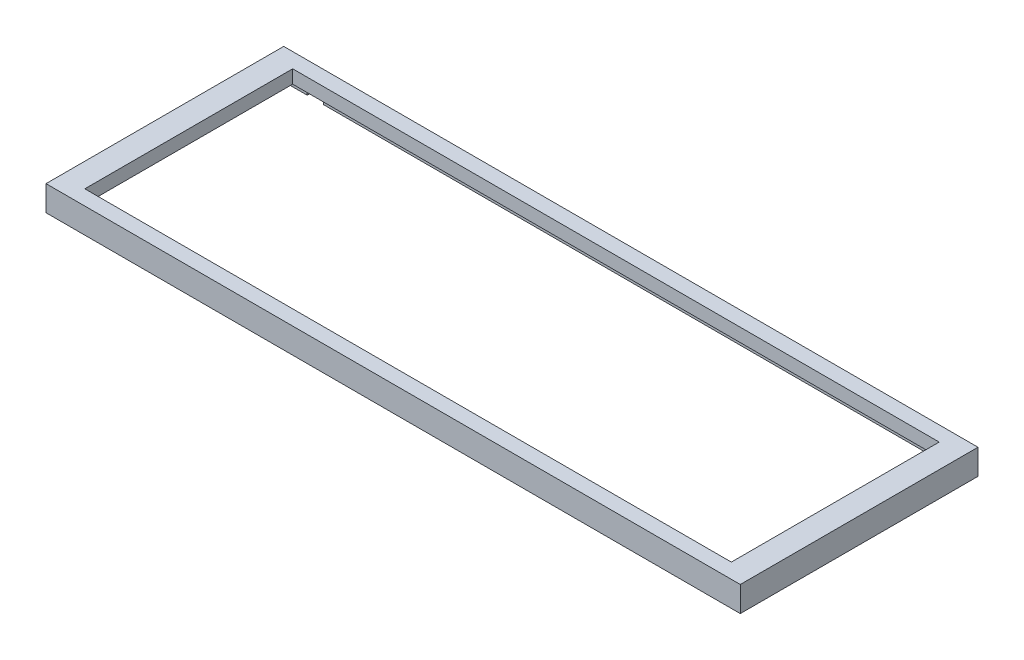
from build123d import *

# Parameters (mm, degrees)
SKETCH1_W           = 390.78
SKETCH1_H           = 133.8
SKETCH1_W_2         = 363.9
SKETCH1_H_2         = 117
BOSS_EXTRUDE1_DEPTH = 7.5
SKETCH2_W           = 390.78
SKETCH2_H           = 133.8
SKETCH2_W_2         = 380
SKETCH2_H_2         = 128.4
BOSS_EXTRUDE2_DEPTH = 6.7
SKETCH4_W           = 9.2
SKETCH4_H           = 5
CUT_EXTRUDE1_DEPTH  = 7.5


with BuildPart() as part:
    # Sketch1 → Boss-Extrude1 (new body)
    with BuildSketch(Plane(origin=(0, 0, 0), x_dir=(1, 0, 0), z_dir=(0, 1, 0))):
        with Locations((181.95, 58.5)):
            Rectangle(SKETCH1_W, SKETCH1_H)
        with Locations((181.95, 58.5)):
            Rectangle(SKETCH1_W_2, SKETCH1_H_2, mode=Mode.SUBTRACT)
    extrude(amount=BOSS_EXTRUDE1_DEPTH)

    # Sketch2 → Boss-Extrude2 (add)
    with BuildSketch(Plane(origin=(0, 0, 0), x_dir=(1, 0, 0), z_dir=(0, 1, 0))):
        with Locations((181.95, 58.5)):
            Rectangle(SKETCH2_W, SKETCH2_H)
        with Locations((181.96, 58.2)):
            Rectangle(SKETCH2_W_2, SKETCH2_H_2, mode=Mode.SUBTRACT)
    extrude(amount=-BOSS_EXTRUDE2_DEPTH)

    # Sketch4 → Cut-Extrude1 (cut)
    with BuildSketch(Plane(origin=(0, 0, -125.4), x_dir=(-1, 0, 0), z_dir=(0, 0, -1))):
        with Locations((-7.36, -4.2)):
            Rectangle(SKETCH4_W, SKETCH4_H)
    extrude(amount=-CUT_EXTRUDE1_DEPTH, mode=Mode.SUBTRACT)


solid = part.part
